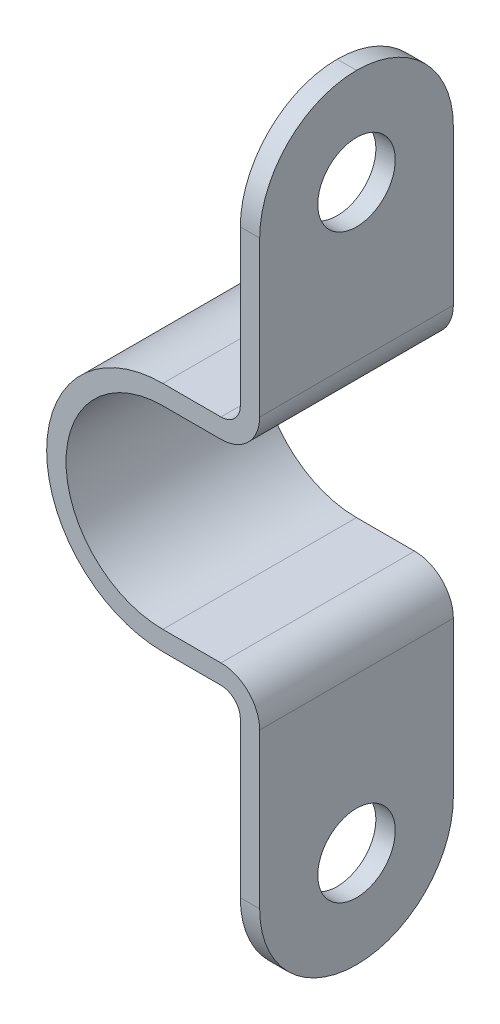
from build123d import *

# Parameters (mm, degrees)
EXTRUDE_1_DEPTH     = 10
FILLET_1_R          = 5
SKETCH_2_R          = 2
CUT_EXTRUDE_1_DEPTH = 25.494897428


with BuildPart() as part:
    # 草图1 → 拉伸-薄壁1 (new body)
    with BuildSketch(Plane.XY):
        with BuildLine():
            Line((5, 20), (5, 7))
            ThreePointArc((5, 7), (4.414213562, 5.585786438), (3, 5))
            Line((3, 5), (0, 5))
            ThreePointArc((0, 5), (-5, 0), (0, -5))
            Line((0, -5), (3, -5))
            ThreePointArc((3, -5), (4.414213562, -5.585786438), (5, -7))
            Line((5, -7), (5, -20))
            Line((5, -20), (4, -20))
            Line((4, -20), (4, -7))
            ThreePointArc((4, -7), (3.707106781, -6.292893219), (3, -6))
            Line((3, -6), (0, -6))
            ThreePointArc((0, -6), (-6, 0), (0, 6))
            Line((0, 6), (3, 6))
            ThreePointArc((3, 6), (3.707106781, 6.292893219), (4, 7))
            Line((4, 7), (4, 20))
            Line((4, 20), (5, 20))
        make_face()
    extrude(amount=EXTRUDE_1_DEPTH)

    # 圆角1
    fillet_1_edges = [part.edges().sort_by_distance(p)[0] for p in [
        (4.5, 20, 10),
        (4.5, 20, 0),
        (4.5, -20, 10),
        (4.5, -20, 0),
    ]]
    fillet(fillet_1_edges, radius=FILLET_1_R - 0.0001)  # a hair under: the kernel refuses the full size

    # 草图2 → 切除-拉伸1 (cut, through all)
    with BuildSketch(Plane.ZY.offset(-4)):
        with Locations(Location((5, -15, 0), (0, 0, 270))):
            Circle(SKETCH_2_R)
        with Locations(Location((5, 15, 0), (0, 0, 270))):
            Circle(SKETCH_2_R)
    extrude(amount=-CUT_EXTRUDE_1_DEPTH, mode=Mode.SUBTRACT)


solid = part.part
